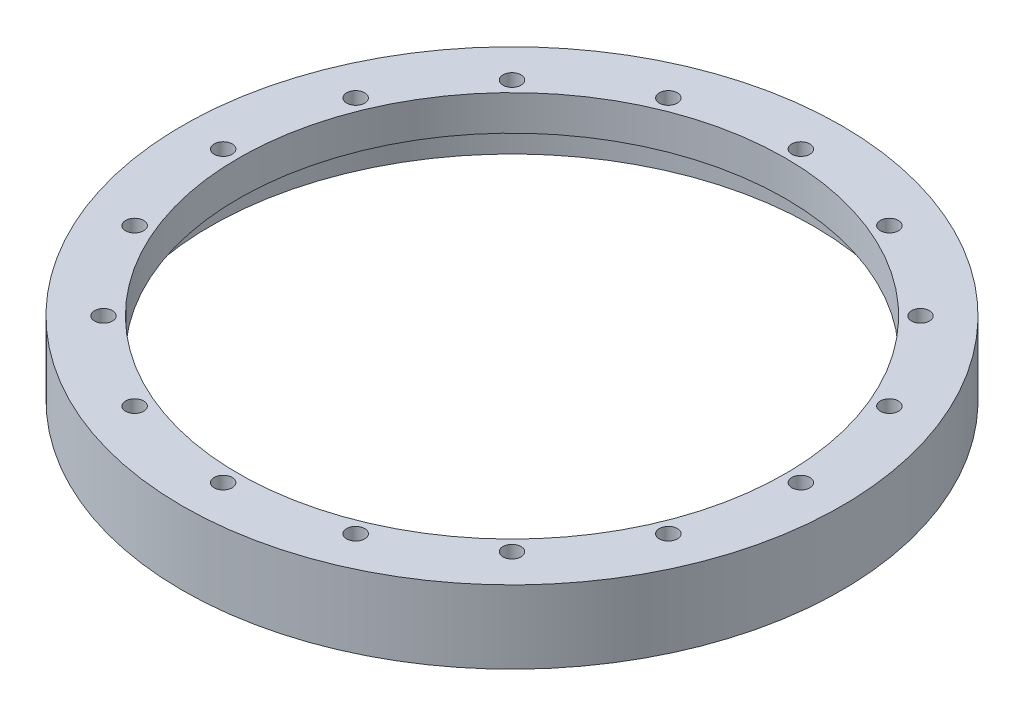
from build123d import *

# Parameters (mm, degrees)
CIRPATTERN1_COUNT = 16


with BuildPart() as part:
    # Sketch1 → Revolve1 (revolve)
    with BuildSketch(Plane.XY):
        Polygon((-49.4665, 0), (-59.6265, 0), (-59.6265, -13.208), (-54.5465, -13.208), (-54.5465, -6.35), (-49.4665, -6.35), align=None)
    revolve(axis=Axis((0, 0, 0), (0, 1, 0)))

    # Sketch3 → #4 Clearance Hole1 (revolve, cut)
    with BuildSketch(Plane(origin=(0, 0, -52.2605), x_dir=(0, 0, 1), z_dir=(1, 0, 0))):
        Polygon((0, 0), (0, 11.140574487), (1.63195, 10.16), (1.63195, 0), align=None)
    f_4_clearance_hole1 = revolve(axis=Axis((0, 6.35, -52.2605), (0, -1, 0)), mode=Mode.SUBTRACT)

    # CirPattern1: #4 Clearance Hole1 ×16 about axis
    cirpattern1_axis = Axis((0, 0, 0), (0, -1, 0))
    for i in range(1, CIRPATTERN1_COUNT):
        add(f_4_clearance_hole1.rotate(cirpattern1_axis, i * 360 / CIRPATTERN1_COUNT), mode=Mode.SUBTRACT)


solid = part.part
